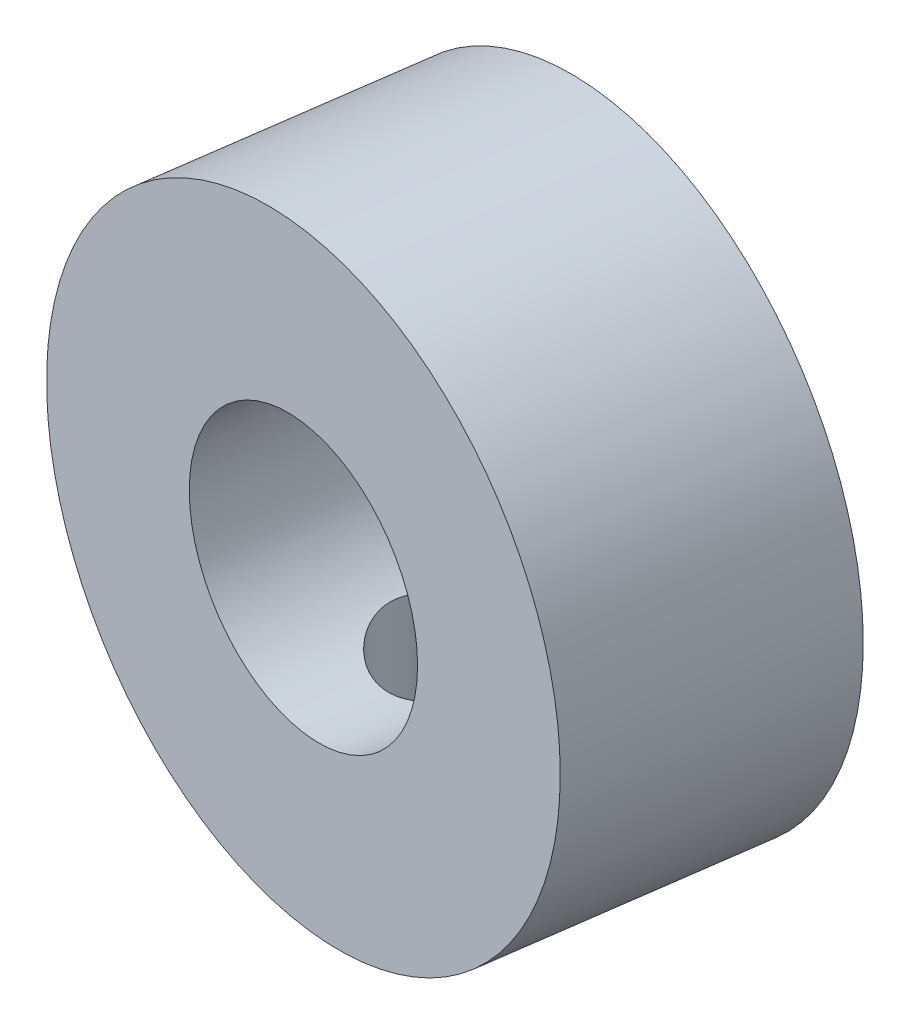
from build123d import *

# Parameters (mm, degrees)
SKETCH1_W                 = 6.35
SKETCH1_H                 = 3.96875
F_6_32_TAPPED_HOLE1_D     = 2.7051
F_6_32_TAPPED_HOLE1_DEPTH = 6.35
F_6_32_TAPPED_HOLE1_TIP   = 0.81269403


with BuildPart() as part:
    # Sketch1 → Revolve1 (revolve)
    with BuildSketch(Plane(origin=(-29.958526336, -0.005469007, 37.92245832), x_dir=(0.13925483139909497, 0, -0.9902565788380351), z_dir=(0.9894272351965835, -0.04091828655590667, 0.13913820494951587))):
        with Locations((53.390881452, -16.29528016)):
            Rectangle(SKETCH1_W, SKETCH1_H)
    revolve(axis=Axis((-23.416944681, -11.132047804, -11.867601806), (0.1392548313990951, 0, -0.9902565788380351)))

    # #6-32 Tapped Hole1
    with Locations(Plane(origin=(0, -18.275797804, 0), x_dir=(-1, 0, 0), z_dir=(0, -1, 0))):
        with Locations((23.264272502, 15.052372025)):
            Hole(F_6_32_TAPPED_HOLE1_D / 2, depth=F_6_32_TAPPED_HOLE1_DEPTH)
            with Locations((0, 0, -(F_6_32_TAPPED_HOLE1_DEPTH + F_6_32_TAPPED_HOLE1_TIP / 2))):  # 118° drill point
                Cone(0, F_6_32_TAPPED_HOLE1_D / 2, F_6_32_TAPPED_HOLE1_TIP, mode=Mode.SUBTRACT)


solid = part.part
